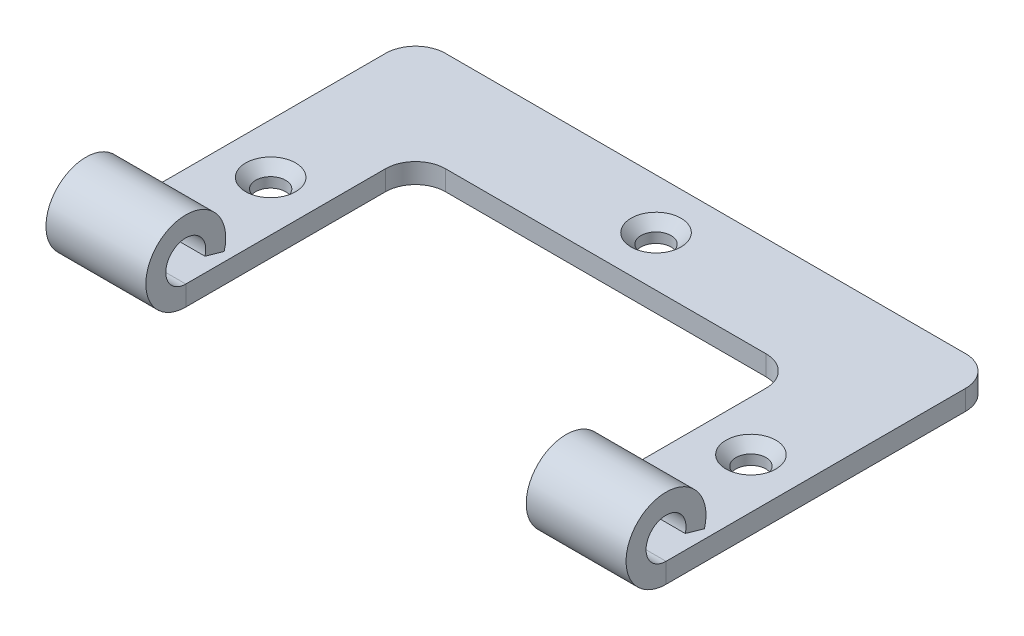
from build123d import *

# Parameters (mm, degrees)
IZIM1_R                     = 1.5
Y_KSEKLIK_EKSTR_ZYON1_DEPTH = 2
Y_KSEKLIK_EKSTR_ZYON2_START = -10
Y_KSEKLIK_EKSTR_ZYON2_DEPTH = 10
Y_KSEKLIK_EKSTR_ZYON3_START = -10
Y_KSEKLIK_EKSTR_ZYON3_DEPTH = 10
KAT_Y_D_N_T_R2_START        = 12.5
KAT_Y_D_N_T_R2_OUTLINE_W    = 10
KAT_Y_D_N_T_R2_OUTLINE_H    = 6
KAT_Y_D_N_T_R2_DEPTH        = 8
KAT_Y_D_N_T_R2_START_2      = 16.5
KAT_Y_D_N_T_R2_2_OUTLINE_W  = 10
KAT_Y_D_N_T_R2_2_OUTLINE_H  = 4
KAT_Y_D_N_T_R2_2_DEPTH      = 4
KENAR_START                 = -29.083147129
KENAR_EKME1_DEPTH           = 10
KENAR_START_2               = 19
KENAR_EKME1_2_DEPTH         = 10
PAH3_SIZE                   = 1


# Read off the part's stored shape, not the designer's step: Katıyı-Dönüştür2, Kenar Çekme1
with BuildPart() as part:
    # Çizim1 → Yükseklik-Ekstrüzyon1 (new body)
    with BuildSketch(Plane(origin=(0, 0, 0), x_dir=(1, 0, 0), z_dir=(0, 1, 0))):
        with BuildLine():
            Line((29, -12.5), (19, -12.5))
            Line((19, -12.5), (19, -6.464101615))
            Line((19, -6.464101615), (19, 3.5))
            ThreePointArc((19, 3.5), (18.121320344, 5.621320344), (16, 6.5))
            Line((16, 6.5), (-3.464101615, 6.5))
            Line((-3.464101615, 6.5), (-16.083147129, 6.5))
            ThreePointArc((-16.083147129, 6.5), (-18.204467472, 5.621320344), (-19.083147129, 3.5))
            Line((-19.083147129, 3.5), (-19.083147129, -6.464101615))
            Line((-19.083147129, -6.464101615), (-19.083147129, -12.5))
            Line((-19.083147129, -12.5), (-29.083147129, -12.5))
            Line((-29.083147129, -12.5), (-29.083147129, 13.5))
            ThreePointArc((-29.083147129, 13.5), (-28.204467472, 15.621320344), (-26.083147129, 16.5))
            Line((-26.083147129, 16.5), (26, 16.5))
            ThreePointArc((26, 16.5), (28.121320344, 15.621320344), (29, 13.5))
            Line((29, 13.5), (29, -12.5))
        make_face()
        with Locations(Location((-24.083147129, -3, 0), (0, 0, 270))):
            Circle(IZIM1_R, mode=Mode.SUBTRACT)
        with Locations(Location((0, 11.5, 0), (0, 0, 270))):
            Circle(IZIM1_R, mode=Mode.SUBTRACT)
        with Locations(Location((24, -3, 0), (0, 0, 270))):
            Circle(IZIM1_R, mode=Mode.SUBTRACT)
    extrude(amount=Y_KSEKLIK_EKSTR_ZYON1_DEPTH)

    # Çizim2 → Yükseklik-Ekstrüzyon2 (add)
    with BuildSketch(Plane(origin=(29, 0, 0), x_dir=(0, 0, -1), z_dir=(1, 0, 0)).offset(Y_KSEKLIK_EKSTR_ZYON2_START)):
        with BuildLine():
            Line((-14.767949192, 3), (-12.627016654, 3))
            ThreePointArc((-12.627016654, 3), (-18.949489743, 7.16227766), (-16.5, 0))
            Line((-16.5, 0), (-12.5, 0))
            Line((-12.5, 0), (-12.5, 2))
            Line((-12.5, 2), (-16.5, 2))
            ThreePointArc((-16.5, 2), (-17.5, 5.732050808), (-14.767949192, 3))
        make_face()
    extrude(amount=Y_KSEKLIK_EKSTR_ZYON2_DEPTH)

    # Çizim3 → Yükseklik-Ekstrüzyon3 (add)
    with BuildSketch(Plane(origin=(-19.083147129, 0, 0), x_dir=(0, 0, -1), z_dir=(1, 0, 0)).offset(Y_KSEKLIK_EKSTR_ZYON3_START)):
        with BuildLine():
            Line((-12.5, 2), (-16.5, 2))
            ThreePointArc((-16.5, 2), (-17.5, 5.732050808), (-14.767949192, 3))
            Line((-14.767949192, 3), (-12.627016654, 3))
            ThreePointArc((-12.627016654, 3), (-18.949489743, 7.16227766), (-16.5, 0))
            Line((-16.5, 0), (-12.5, 0))
            Line((-12.5, 0), (-12.5, 2))
        make_face()
    extrude(amount=Y_KSEKLIK_EKSTR_ZYON3_DEPTH)

    # Katıyı-Dönüştür2 outline → Katıyı-Dönüştür2 (cut)
    with BuildSketch(Plane.XY.offset(KAT_Y_D_N_T_R2_START)):
        with Locations((24, 6)):
            Rectangle(KAT_Y_D_N_T_R2_OUTLINE_W, KAT_Y_D_N_T_R2_OUTLINE_H)
        with Locations((-24.083147129, 6)):
            Rectangle(KAT_Y_D_N_T_R2_OUTLINE_W, KAT_Y_D_N_T_R2_OUTLINE_H)
    extrude(amount=KAT_Y_D_N_T_R2_DEPTH, mode=Mode.SUBTRACT)

    # Kat_y_-D_n_t_r2 2 outline → Kat_y_-D_n_t_r2 2 (cut)
    with BuildSketch(Plane.XY.offset(KAT_Y_D_N_T_R2_START_2)):
        with Locations((24, 1)):
            Rectangle(KAT_Y_D_N_T_R2_2_OUTLINE_W, KAT_Y_D_N_T_R2_2_OUTLINE_H)
        with Locations((-24.083147129, 1)):
            Rectangle(KAT_Y_D_N_T_R2_2_OUTLINE_W, KAT_Y_D_N_T_R2_2_OUTLINE_H)
    extrude(amount=KAT_Y_D_N_T_R2_2_DEPTH, mode=Mode.SUBTRACT)

    # Kenar Çekme1 outline → Kenar Çekme1 (add)
    with BuildSketch(Plane.YZ.offset(KENAR_START)):
        with BuildLine():
            Line((3.448725288, 14.577476608), (2.897450577, 12.654953216))
            ThreePointArc((2.897450577, 12.654953216), (7.19454204, 18.907260093), (0, 16.5))
            Line((0, 16.5), (2, 16.5))
            ThreePointArc((2, 16.5), (5.59727102, 17.703630046), (3.448725288, 14.577476608))
        make_face()
    extrude(amount=KENAR_EKME1_DEPTH)

    # Kenar _ekme1 2 outline → Kenar _ekme1 2 (add)
    with BuildSketch(Plane.YZ.offset(KENAR_START_2)):
        with BuildLine():
            Line((3.448725288, 14.577476608), (2.897450577, 12.654953216))
            ThreePointArc((2.897450577, 12.654953216), (7.19454204, 18.907260093), (0, 16.5))
            Line((0, 16.5), (2, 16.5))
            ThreePointArc((2, 16.5), (5.59727102, 17.703630046), (3.448725288, 14.577476608))
        make_face()
    extrude(amount=KENAR_EKME1_2_DEPTH)

    # Pah3
    pah3_edges = [part.edges().sort_by_distance(p)[0] for p in [
        (24, 2, 1.5),
        (-24.083147129, 2, 1.5),
        (0, 2, -13),
    ]]
    chamfer(pah3_edges, length=PAH3_SIZE)


solid = part.part
